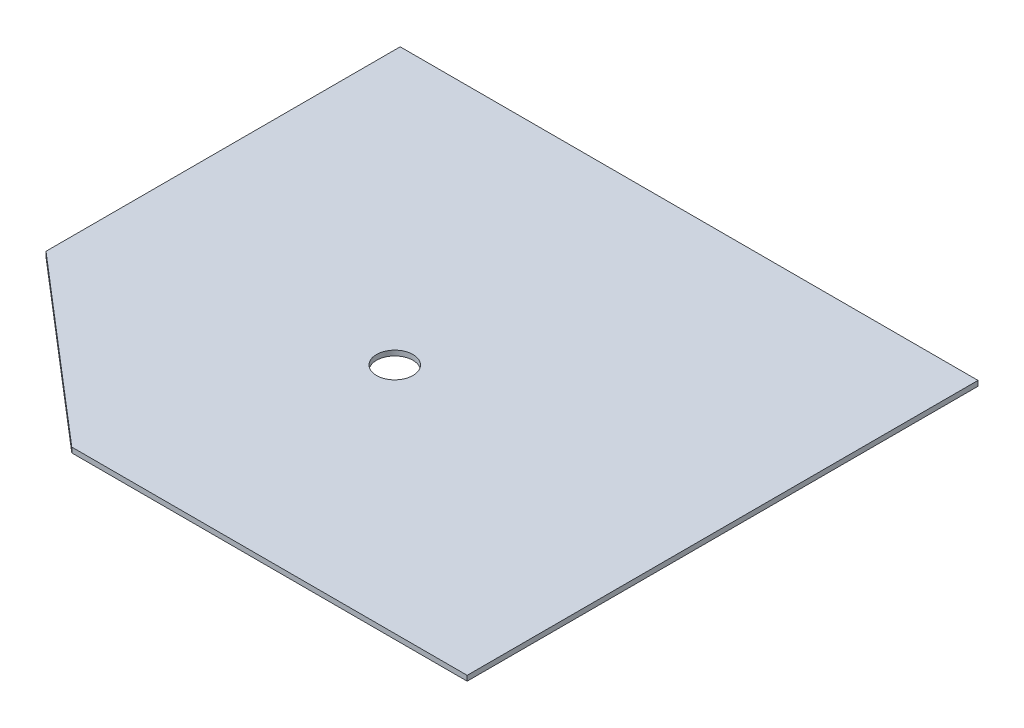
from build123d import *

# Parameters (mm, degrees)
SKETCH1_W           = 452.46
SKETCH1_H           = 400
BOSS_EXTRUDE1_DEPTH = 4
SKETCH2_R           = 14.275
CUT_EXTRUDE1_DEPTH  = 324.316513184
CUT_EXTRUDE2_DEPTH  = 324.316513184


with BuildPart() as part:
    # Sketch1 → Boss-Extrude1 (new body)
    with BuildSketch(Plane(origin=(0, 0, 0), x_dir=(1, 0, 0), z_dir=(0, 1, 0))):
        with Locations((12.58495796, 17.91049436)):
            Rectangle(SKETCH1_W, SKETCH1_H)
    extrude(amount=BOSS_EXTRUDE1_DEPTH)

    # Sketch2 → Cut-Extrude1 (cut, through all)
    with BuildSketch(Plane.XZ.offset(-4)):
        Circle(SKETCH2_R)
    extrude(amount=CUT_EXTRUDE1_DEPTH, mode=Mode.SUBTRACT)

    # Sketch3 → Cut-Extrude2 (cut, through all)
    with BuildSketch(Plane(origin=(0, 4, 0), x_dir=(1, 0, 0), z_dir=(0, 1, 0))):
        Polygon((-70.791344552, -182.08950564), (-213.64504204, -59.421992734), (-317.358115476, -168.108607174), (-142.218193296, -320.092437945), align=None)
    extrude(amount=-CUT_EXTRUDE2_DEPTH, mode=Mode.SUBTRACT)


solid = part.part
